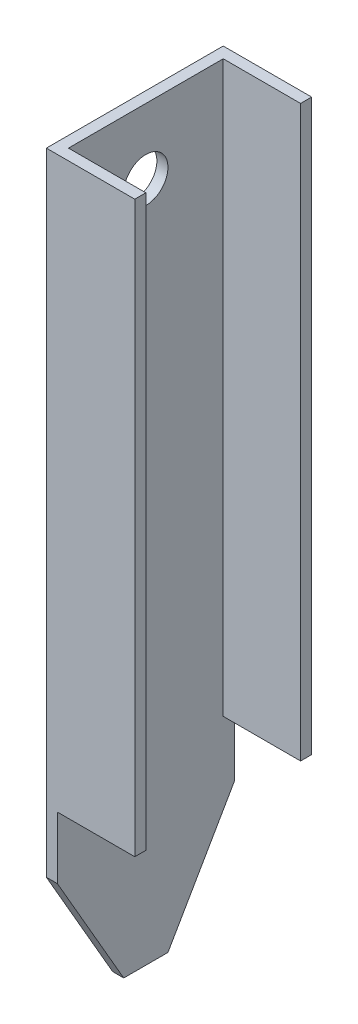
from build123d import *

# Parameters (mm, degrees)
BOSS_EXTRUDE1_DEPTH = 107.188
SKETCH2_W           = 22.225
SKETCH2_H           = 50.8
CUT_EXTRUDE1_DEPTH  = 208.026
SKETCH3_R           = 6.35
CUT_EXTRUDE2_DEPTH  = 45.974
CHAMFER1_SIZE       = 19.05
CHAMFER1_SIZE2      = 32.995567884
CHAMFER2_SIZE       = 19.05
CHAMFER2_SIZE2      = 32.995567884


with BuildPart() as part:
    # Sketch1 → Boss-Extrude1 (new, symmetric)
    with BuildSketch(Plane(origin=(0, 0, 0), x_dir=(1, 0, 0), z_dir=(0, 1, 0))):
        Polygon((-20.955, 0), (-20.955, 25.4), (4.445, 25.4), (4.445, 22.225), (-17.78, 22.225), (-17.78, -22.225), (4.445, -22.225), (4.445, -25.4), (-20.955, -25.4), align=None)
    extrude(amount=BOSS_EXTRUDE1_DEPTH, both=True)

    # Sketch2 → Cut-Extrude1 (cut)
    with BuildSketch(Plane.XY.offset(25.4)):
        with Locations((-6.6675, -81.788)):
            Rectangle(SKETCH2_W, SKETCH2_H)
    extrude(amount=-CUT_EXTRUDE1_DEPTH, mode=Mode.SUBTRACT)

    # Sketch3 → Cut-Extrude2 (cut)
    with BuildSketch(Plane.ZY.offset(20.955)):
        with Locations((0, 88.138)):
            Circle(SKETCH3_R)
    extrude(amount=-CUT_EXTRUDE2_DEPTH, mode=Mode.SUBTRACT)

    # Chamfer1
    chamfer1_edges = [part.edges().sort_by_distance(p)[0] for p in [
        (-19.3675, -107.188, -25.4),
    ]]
    chamfer1_side = [part.faces().sort_by_distance(p)[0] for p in [
        (-19.3675, -107.188, 0),
    ]]
    chamfer(chamfer1_edges, length=CHAMFER1_SIZE, length2=CHAMFER1_SIZE2, reference=chamfer1_side[0])

    # Chamfer2
    chamfer2_edges = [part.edges().sort_by_distance(p)[0] for p in [
        (-19.3675, -107.188, 25.4),
    ]]
    chamfer2_side = [part.faces().sort_by_distance(p)[0] for p in [
        (-19.3675, -107.188, 9.525),
    ]]
    chamfer(chamfer2_edges, length=CHAMFER2_SIZE, length2=CHAMFER2_SIZE2, reference=chamfer2_side[0])


solid = part.part
